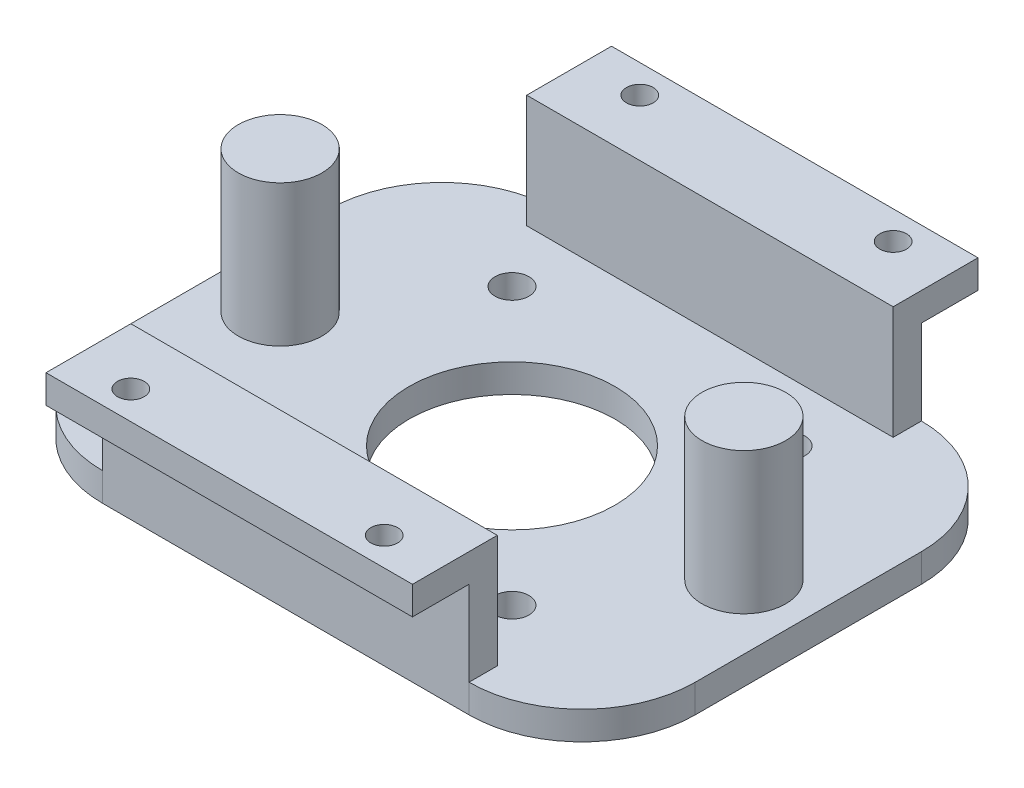
from build123d import *

# Parameters (mm, degrees)
SKETCH1_W           = 41.148
SKETCH1_H           = 50.8
SKETCH1_R           = 11.557
SKETCH1_R_2         = 1.905
BOSS_EXTRUDE1_DEPTH = 3.175
SKETCH2_W           = 41.148
SKETCH2_H           = 3.175
BOSS_EXTRUDE2_DEPTH = 12.7
SKETCH3_W           = 41.148
SKETCH3_H           = 3.175
BOSS_EXTRUDE3_DEPTH = 6.35
SKETCH4_W           = 41.148
SKETCH4_H           = 3.175
BOSS_EXTRUDE4_DEPTH = 6.35
SKETCH5_R           = 1.5
CUT_EXTRUDE1_DEPTH  = 6.35
BOSS_EXTRUDE5_DEPTH = 12.7
BOSS_EXTRUDE6_DEPTH = 12.7
SKETCH8_R           = 4.699
BOSS_EXTRUDE7_DEPTH = 19.05
FILLET1_R           = 12.7


with BuildPart() as part:
    # Sketch1 → Boss-Extrude1 (new body)
    with BuildSketch(Plane(origin=(0, 0, 0), x_dir=(1, 0, 0), z_dir=(0, 1, 0))):
        Rectangle(SKETCH1_W, SKETCH1_H)
        Circle(SKETCH1_R, mode=Mode.SUBTRACT)
        with Locations((-15.499999988, 15.499999988)):
            Circle(SKETCH1_R_2, mode=Mode.SUBTRACT)
        with Locations((15.499999988, 15.499999988)):
            Circle(SKETCH1_R_2, mode=Mode.SUBTRACT)
        with Locations((15.499999988, -15.499999988)):
            Circle(SKETCH1_R_2, mode=Mode.SUBTRACT)
        with Locations((-15.499999988, -15.499999988)):
            Circle(SKETCH1_R_2, mode=Mode.SUBTRACT)
    extrude(amount=BOSS_EXTRUDE1_DEPTH)

    # Sketch2 → Boss-Extrude2 (add)
    with BuildSketch(Plane(origin=(0, 3.175, 0), x_dir=(1, 0, 0), z_dir=(0, 1, 0))):
        with Locations((0, -23.8125)):
            Rectangle(SKETCH2_W, SKETCH2_H)
        with Locations((0, 23.8125)):
            Rectangle(SKETCH2_W, SKETCH2_H)
    extrude(amount=BOSS_EXTRUDE2_DEPTH)

    # Sketch3 → Boss-Extrude3 (add)
    with BuildSketch(Plane(origin=(0, 0, -25.4), x_dir=(-1, 0, 0), z_dir=(0, 0, -1))):
        with Locations((0, 14.2875)):
            Rectangle(SKETCH3_W, SKETCH3_H)
    extrude(amount=BOSS_EXTRUDE3_DEPTH)

    # Sketch4 → Boss-Extrude4 (add)
    with BuildSketch(Plane.XY.offset(25.4)):
        with Locations((0, 14.2875)):
            Rectangle(SKETCH4_W, SKETCH4_H)
    extrude(amount=BOSS_EXTRUDE4_DEPTH)

    # Sketch5 → Cut-Extrude1 (cut)
    with BuildSketch(Plane.XZ.offset(-12.7)):
        with Locations((-14.224, 28.575)):
            Circle(SKETCH5_R)
        with Locations((14.224, 28.575)):
            Circle(SKETCH5_R)
        with Locations((14.224, -28.575)):
            Circle(SKETCH5_R)
        with Locations((-14.224, -28.575)):
            Circle(SKETCH5_R)
    extrude(amount=-CUT_EXTRUDE1_DEPTH, mode=Mode.SUBTRACT)

    # Sketch6 → Boss-Extrude5 (add)
    with BuildSketch(Plane.ZY.offset(20.574)):
        Polygon((-25.4, 0), (25.4, 0), (25.4, 3.175), (22.225, 3.175), (-22.225, 3.175), (-25.4, 3.175), align=None)
    extrude(amount=BOSS_EXTRUDE5_DEPTH)

    # Sketch7 → Boss-Extrude6 (add)
    with BuildSketch(Plane(origin=(20.574, 0, 0), x_dir=(0, 0, -1), z_dir=(1, 0, 0))):
        Polygon((-25.4, 0), (25.4, 0), (25.4, 3.175), (22.225, 3.175), (-22.225, 3.175), (-25.4, 3.175), align=None)
    extrude(amount=BOSS_EXTRUDE6_DEPTH)

    # Sketch8 → Boss-Extrude7 (add)
    with BuildSketch(Plane.XZ):
        with Locations((-26.035, 0)):
            Circle(SKETCH8_R)
        with Locations((26.035, 0)):
            Circle(SKETCH8_R)
    extrude(amount=-BOSS_EXTRUDE7_DEPTH)

    # Fillet1
    fillet1_edges = [part.edges().sort_by_distance(p)[0] for p in [
        (-33.274, 1.5875, -25.4),
        (33.274, 1.5875, -25.4),
        (33.274, 1.5875, 25.4),
        (-33.274, 1.5875, 25.4),
    ]]
    fillet(fillet1_edges, radius=FILLET1_R)


solid = part.part
